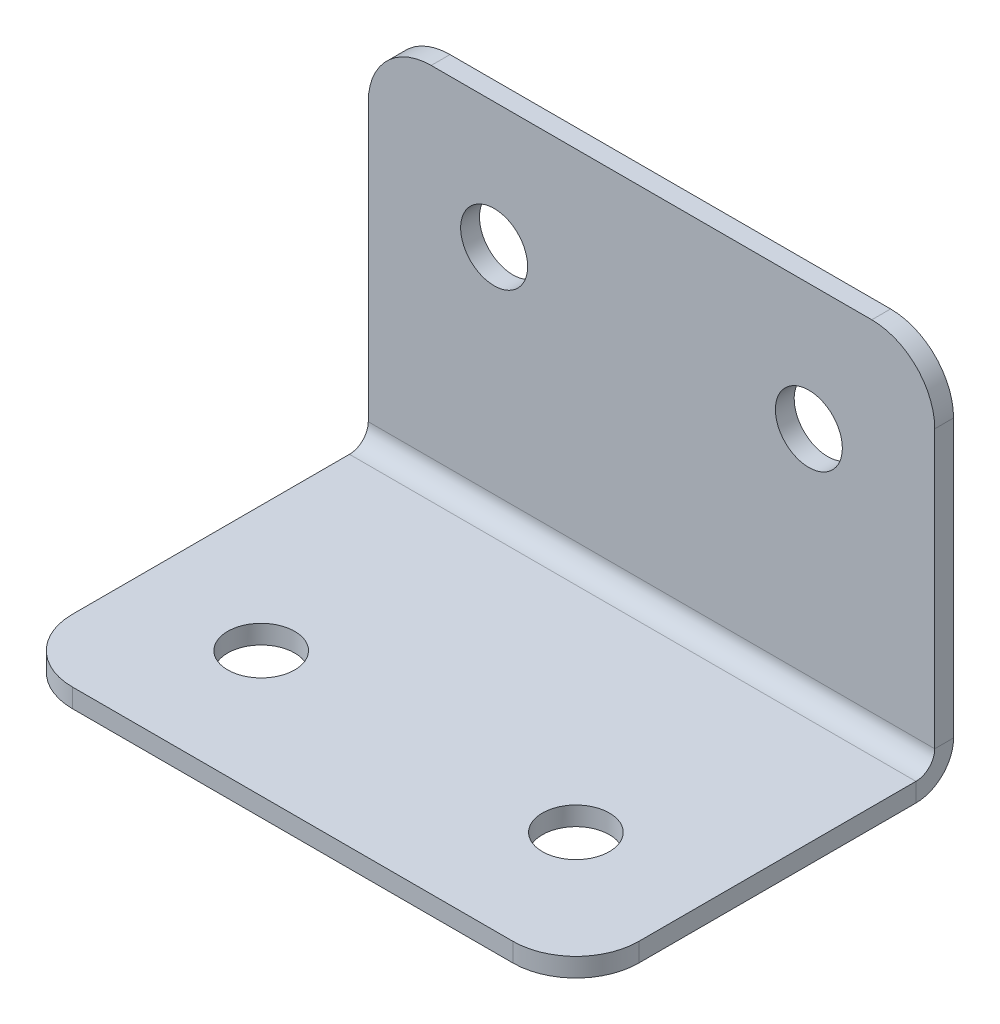
from build123d import *

# Parameters (mm, degrees)
SKETCH1_W                    = 57.15
SKETCH1_H                    = 38.1
BASE_FLANGE1_DEPTH           = 1.89738
EDGE_FLANGE1_STRIP_W         = 11.38428
EDGE_FLANGE1_STRIP_H         = 1.89738
EDGE_FLANGE1_STRIP_CUT_DEPTH = 57.15
EDGE_FLANGE1_DEPTH           = 57.15
F_1_4_CLEARANCE_HOLE1_D      = 6.7564
F_1_4_CLEARANCE_HOLE2_D      = 6.7564
FILLET1_R                    = 6.35


# Sheet-metal steps are written as plain solids
with BuildPart() as part:
    # Sketch1 → Base-Flange1 (new body)
    with BuildSketch(Plane(origin=(0, 0, 0), x_dir=(1, 0, 0), z_dir=(0, 1, 0))):
        with Locations((0, -19.05)):
            Rectangle(SKETCH1_W, SKETCH1_H)
    extrude(amount=BASE_FLANGE1_DEPTH)

    # Edge-Flange1 strip (across the edge) → Edge-Flange1 strip cut (cut)
    with BuildSketch(Plane(origin=(28.575, 1.89738, 0), x_dir=(0, 0, 1), z_dir=(-1, 0, 0))):
        with Locations((-1.89738, -0.94869)):
            Rectangle(EDGE_FLANGE1_STRIP_W, EDGE_FLANGE1_STRIP_H)
    extrude(amount=EDGE_FLANGE1_STRIP_CUT_DEPTH, mode=Mode.SUBTRACT)

    # Edge-Flange1 section (across the edge) → Edge-Flange1 (add)
    with BuildSketch(Plane(origin=(28.575, 1.89738, 0), x_dir=(0, 0, 1), z_dir=(-1, 0, 0))):
        with BuildLine():
            Line((0, 1.89738), (0, 36.20262))
            Line((0, 36.20262), (1.89738, 36.20262))
            Line((1.89738, 36.20262), (1.89738, 1.89738))
            ThreePointArc((1.89738, 1.89738), (2.453109736, 0.555729736), (3.79476, 0))
            Line((3.79476, 0), (3.79476, -1.89738))
            ThreePointArc((3.79476, -1.89738), (1.111459471, -0.785920529), (0, 1.89738))
        make_face()
    extrude(amount=EDGE_FLANGE1_DEPTH)

    # 1/4 Clearance Hole1 (through all)
    with Locations(Plane(origin=(0, 1.89738, 0), x_dir=(1, 0, 0), z_dir=(0, 1, 0))):
        with Locations((-15.875, -25.4), (15.875, -25.4)):
            Hole(F_1_4_CLEARANCE_HOLE1_D / 2)

    # 1/4 Clearance Hole2 (through all)
    with Locations(Plane.XY.offset(1.89738)):
        with Locations((-15.875, 25.4), (15.875, 25.4)):
            Hole(F_1_4_CLEARANCE_HOLE2_D / 2)

    # Fillet1
    fillet1_edges = [part.edges().sort_by_distance(p)[0] for p in [
        (28.575, 38.1, 0.94869),
        (-28.575, 38.1, 0.94869),
        (28.575, 0.94869, 38.1),
        (-28.575, 0.94869, 38.1),
    ]]
    fillet(fillet1_edges, radius=FILLET1_R)


solid = part.part
